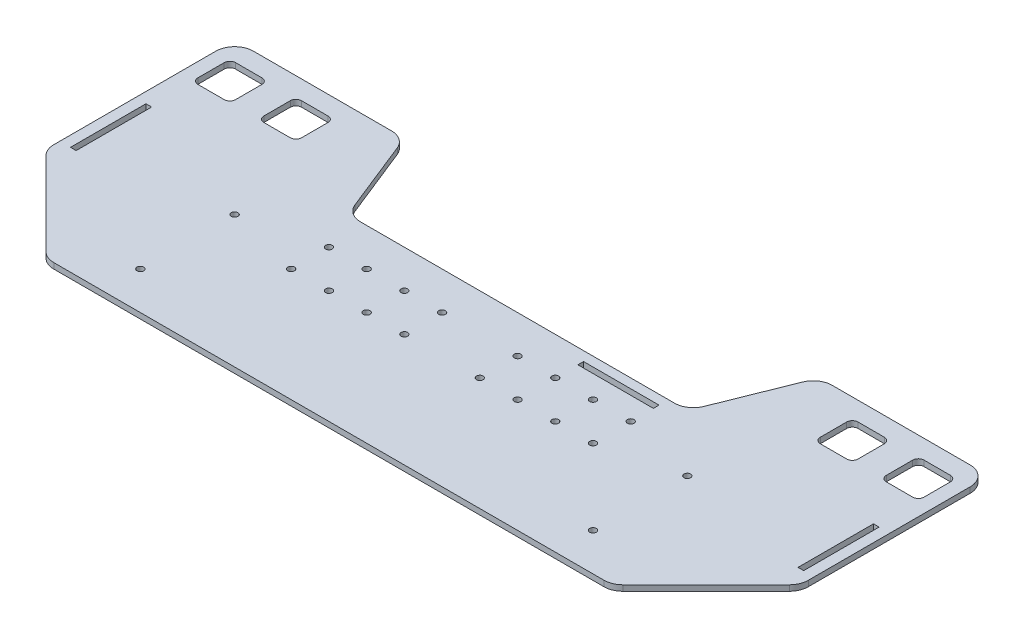
from build123d import *

# Parameters (mm, degrees)
EXTRUDE_1_DEPTH     = 3
SKETCH_3_R          = 1.75
CUT_EXTRUDE_1_DEPTH = 69
CUT_EXTRUDE_2_DEPTH = 69
SKETCH_5_W          = 3
SKETCH_5_H          = 40
CUT_EXTRUDE_3_DEPTH = 3
SKETCH_6_R          = 1.75
CUT_EXTRUDE_4_DEPTH = 4
SKETCH_7_W          = 40
SKETCH_7_H          = 3
CUT_EXTRUDE_5_DEPTH = 4


with BuildPart() as part:
    # 草图1 → 凸台-拉伸1 (new body)
    with BuildSketch(Plane(origin=(0, 0, 0), x_dir=(1, 0, 0), z_dir=(0, 1, 0))):
        with BuildLine():
            Line((-197.071067812, -27.928932188), (-152.928932188, -72.071067812))
            ThreePointArc((-152.928932188, -72.071067812), (-149.6846987, -74.238795325), (-145.857864376, -75))
            Line((-145.857864376, -75), (145.857864376, -75))
            ThreePointArc((145.857864376, -75), (149.6846987, -74.238795325), (152.928932188, -72.071067812))
            Line((152.928932188, -72.071067812), (197.071067812, -27.928932188))
            ThreePointArc((197.071067812, -27.928932188), (199.238795325, -24.6846987), (200, -20.857864376))
            Line((200, -20.857864376), (200, 65))
            ThreePointArc((200, 65), (197.071067812, 72.071067812), (190, 75))
            Line((190, 75), (116.770329614, 75))
            ThreePointArc((116.770329614, 75), (111.164041521, 73.280672305), (107.485562705, 68.713906764))
            Line((107.485562705, 68.713906764), (92.514437295, 31.286093236))
            ThreePointArc((92.514437295, 31.286093236), (88.835958479, 26.719327695), (83.229670386, 25))
            Line((83.229670386, 25), (-83.229670386, 25))
            ThreePointArc((-83.229670386, 25), (-88.835958479, 26.719327695), (-92.514437295, 31.286093236))
            Line((-92.514437295, 31.286093236), (-107.485562705, 68.713906764))
            ThreePointArc((-107.485562705, 68.713906764), (-111.164041521, 73.280672305), (-116.770329614, 75))
            Line((-116.770329614, 75), (-190, 75))
            ThreePointArc((-190, 75), (-197.071067812, 72.071067812), (-200, 65))
            Line((-200, 65), (-200, -20.857864376))
            ThreePointArc((-200, -20.857864376), (-199.238795325, -24.6846987), (-197.071067812, -27.928932188))
        make_face()
    extrude(amount=EXTRUDE_1_DEPTH)

    # 草图3 → 切除-拉伸1 (cut)
    with BuildSketch(Plane.XZ):
        with Locations((-120, 55)):
            Circle(SKETCH_3_R)
        with Locations((-120, 5)):
            Circle(SKETCH_3_R)
        with Locations((120, 5)):
            Circle(SKETCH_3_R)
        with Locations((120, 55)):
            Circle(SKETCH_3_R)
    extrude(amount=-CUT_EXTRUDE_1_DEPTH, mode=Mode.SUBTRACT)

    # 草图4 → 切除-拉伸2 (cut)
    with BuildSketch(Plane(origin=(0, 3, 0), x_dir=(1, 0, 0), z_dir=(0, 1, 0))):
        with BuildLine():
            Line((-140.5, 45), (-154.5, 45))
            ThreePointArc((-154.5, 45), (-156.621320344, 45.878679656), (-157.5, 48))
            Line((-157.5, 48), (-157.5, 62))
            ThreePointArc((-157.5, 62), (-156.621320344, 64.121320344), (-154.5, 65))
            Line((-154.5, 65), (-140.5, 65))
            ThreePointArc((-140.5, 65), (-138.378679656, 64.121320344), (-137.5, 62))
            Line((-137.5, 62), (-137.5, 48))
            ThreePointArc((-137.5, 48), (-138.378679656, 45.878679656), (-140.5, 45))
        make_face()
        with BuildLine():
            Line((-175.5, 45), (-189.5, 45))
            ThreePointArc((-189.5, 45), (-191.621320344, 45.878679656), (-192.5, 48))
            Line((-192.5, 48), (-192.5, 62))
            ThreePointArc((-192.5, 62), (-191.621320344, 64.121320344), (-189.5, 65))
            Line((-189.5, 65), (-175.5, 65))
            ThreePointArc((-175.5, 65), (-173.378679656, 64.121320344), (-172.5, 62))
            Line((-172.5, 62), (-172.5, 48))
            ThreePointArc((-172.5, 48), (-173.378679656, 45.878679656), (-175.5, 45))
        make_face()
        with BuildLine():
            Line((192.5, 48), (192.5, 62))
            ThreePointArc((192.5, 62), (191.621320344, 64.121320344), (189.5, 65))
            Line((189.5, 65), (175.5, 65))
            ThreePointArc((175.5, 65), (173.378679656, 64.121320344), (172.5, 62))
            Line((172.5, 62), (172.5, 48))
            ThreePointArc((172.5, 48), (173.378679656, 45.878679656), (175.5, 45))
            Line((175.5, 45), (189.5, 45))
            ThreePointArc((189.5, 45), (191.621320344, 45.878679656), (192.5, 48))
        make_face()
        with BuildLine():
            Line((157.5, 48), (157.5, 62))
            ThreePointArc((157.5, 62), (156.621320344, 64.121320344), (154.5, 65))
            Line((154.5, 65), (140.5, 65))
            ThreePointArc((140.5, 65), (138.378679656, 64.121320344), (137.5, 62))
            Line((137.5, 62), (137.5, 48))
            ThreePointArc((137.5, 48), (138.378679656, 45.878679656), (140.5, 45))
            Line((140.5, 45), (154.5, 45))
            ThreePointArc((154.5, 45), (156.621320344, 45.878679656), (157.5, 48))
        make_face()
    extrude(amount=-CUT_EXTRUDE_2_DEPTH, mode=Mode.SUBTRACT)

    # 草图5 → 切除-拉伸3 (cut)
    with BuildSketch(Plane.XZ):
        with Locations((192.86, -2.35)):
            Rectangle(SKETCH_5_W, SKETCH_5_H)
        with Locations((-192.86, -2.35)):
            Rectangle(SKETCH_5_W, SKETCH_5_H)
    extrude(amount=-CUT_EXTRUDE_3_DEPTH, mode=Mode.SUBTRACT)

    # 草图6 → 切除-拉伸4 (cut)
    with BuildSketch(Plane.XZ):
        with Locations((20, -5)):
            Circle(SKETCH_6_R)
        with Locations((40, -5)):
            Circle(SKETCH_6_R)
        with Locations((60, -5)):
            Circle(SKETCH_6_R)
        with Locations((80, -5)):
            Circle(SKETCH_6_R)
        with Locations((40, 15)):
            Circle(SKETCH_6_R)
        with Locations((60, 15)):
            Circle(SKETCH_6_R)
        with Locations((80, 15)):
            Circle(SKETCH_6_R)
        with Locations((20, 15)):
            Circle(SKETCH_6_R)
        with Locations((-20, 15)):
            Circle(SKETCH_6_R)
        with Locations((-80, 15)):
            Circle(SKETCH_6_R)
        with Locations((-60, 15)):
            Circle(SKETCH_6_R)
        with Locations((-40, 15)):
            Circle(SKETCH_6_R)
        with Locations((-80, -5)):
            Circle(SKETCH_6_R)
        with Locations((-60, -5)):
            Circle(SKETCH_6_R)
        with Locations((-40, -5)):
            Circle(SKETCH_6_R)
        with Locations((-20, -5)):
            Circle(SKETCH_6_R)
    extrude(amount=-CUT_EXTRUDE_4_DEPTH, mode=Mode.SUBTRACT)

    # 草图7 → 切除-拉伸5 (cut)
    with BuildSketch(Plane.XZ):
        with Locations((60, -18.5)):
            Rectangle(SKETCH_7_W, SKETCH_7_H)
    extrude(amount=-CUT_EXTRUDE_5_DEPTH, mode=Mode.SUBTRACT)


solid = part.part
